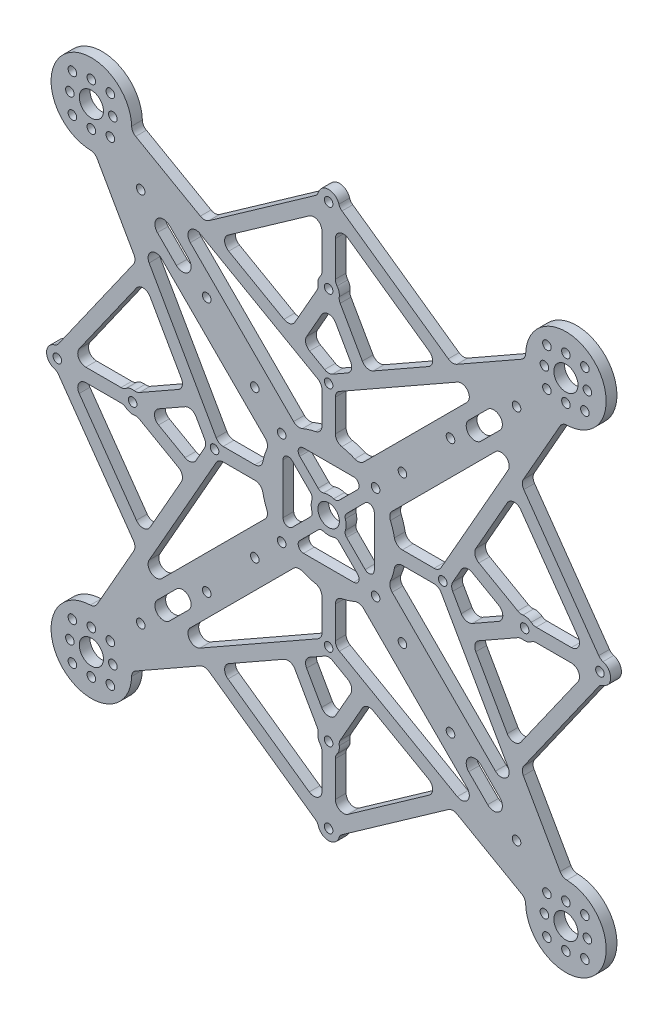
from build123d import *
from build123d.topology import SkipClean

# Parameters (mm, degrees)
SKETCH_1_W                 = 212.132034356
SKETCH_1_H                 = 212.132034356
SKETCH_1_R                 = 4.5
EXTRUDE_1_DEPTH            = 4
SKETCH_5_R                 = 1.6
CUT_EXTRUDE_5_DEPTH        = 4
SKETCH_6_R                 = 1.6
CUT_EXTRUDE_6_DEPTH        = 4
SKETCH_7_R                 = 4
CUT_EXTRUDE_9_DEPTH        = 10
FILLET_3_R                 = 2
SKETCH_8_R                 = 1.6
CUT_EXTRUDE_10_DEPTH       = 10
CUT_EXTRUDE_11_DEPTH       = 10
EXTRUDE_START              = -4
EXTRUDE_5_DEPTH            = 4
MIRROR_START               = -4
MIRROR_2_COPY_1_DEPTH      = 4
MIRROR_3_COPY_1_DEPTH      = 4
MIRROR_3_COPY_2_DEPTH      = 4
MIRROR_3_COPY_3_DEPTH      = 4
CUT_EXTRUDE_12_DEPTH       = 4
SKETCH_12_R                = 1.6
CUT_EXTRUDE_13_DEPTH       = 4
SKETCH_13_R                = 4
SKETCH_13_R_2              = 1.6
EXTRUDE_6_DEPTH            = 4
MIRROR_5_COPY_1_SKETCH_R   = 4
MIRROR_5_COPY_1_SKETCH_R_2 = 1.6
MIRROR_5_COPY_1_DEPTH      = 4
MIRROR_6_COPY_1_SKETCH_R   = 4
MIRROR_6_COPY_1_SKETCH_R_2 = 1.6
MIRROR_6_COPY_1_DEPTH      = 4
MIRROR_6_COPY_2_SKETCH_R   = 4
MIRROR_6_COPY_2_SKETCH_R_2 = 1.6
MIRROR_6_COPY_2_DEPTH      = 4
MIRROR_6_COPY_3_SKETCH_R   = 4
MIRROR_6_COPY_3_SKETCH_R_2 = 1.6
MIRROR_6_COPY_3_DEPTH      = 4
CUT_EXTRUDE_14_DEPTH       = 4
PATTERN_CIRCULAR_1_COUNT   = 4
FILLET_4_R                 = 3
SKETCH_15_R                = 1.6
CUT_EXTRUDE_15_DEPTH       = 10
CUT_EXTRUDE_16_DEPTH       = 10


# Read off the part's stored shape, not the designer's step: 凸台-拉伸5
with BuildPart() as part:
    # 草图1 → 凸台-拉伸1 (new body)
    with BuildSketch(Plane.XY):
        Rectangle(SKETCH_1_W, SKETCH_1_H)
        with Locations((-88.388347648, -88.388347648)):
            Circle(SKETCH_1_R, mode=Mode.SUBTRACT)
        with Locations((88.388347648, -88.388347648)):
            Circle(SKETCH_1_R, mode=Mode.SUBTRACT)
        with Locations(Location((88.388347648, 88.388347648, 0), (0, 0, 180))):
            Circle(SKETCH_1_R, mode=Mode.SUBTRACT)
        with Locations(Location((-88.388347648, 88.388347648, 0), (0, 0, 180))):
            Circle(SKETCH_1_R, mode=Mode.SUBTRACT)
    extrude(amount=EXTRUDE_1_DEPTH)

    # 草图5 → 切除-拉伸5 (cut)
    with BuildSketch(Plane.XY.offset(4)):
        with Locations((96.388347648, -88.388347648)):
            Circle(SKETCH_5_R)
        with Locations((88.388347648, -96.388347648)):
            Circle(SKETCH_5_R)
        with Locations(Location((80.388347648, -88.388347648, 0), (0, 0, 180))):
            Circle(SKETCH_5_R)
        with Locations(Location((88.388347648, -80.388347648, 0), (0, 0, 180))):
            Circle(SKETCH_5_R)
        with Locations((-88.388347648, -80.388347648)):
            Circle(SKETCH_5_R)
        with Locations((-80.388347648, -88.388347648)):
            Circle(SKETCH_5_R)
        with Locations(Location((-88.388347648, -96.388347648, 0), (0, 0, 180))):
            Circle(SKETCH_5_R)
        with Locations(Location((-96.388347648, -88.388347648, 0), (0, 0, 180))):
            Circle(SKETCH_5_R)
        with Locations((-96.388347648, 88.388347648)):
            Circle(SKETCH_5_R)
        with Locations((-88.388347648, 96.388347648)):
            Circle(SKETCH_5_R)
        with Locations(Location((-80.388347648, 88.388347648, 0), (0, 0, 180))):
            Circle(SKETCH_5_R)
        with Locations(Location((-88.388347648, 80.388347648, 0), (0, 0, 180))):
            Circle(SKETCH_5_R)
        with Locations((88.388347648, 80.388347648)):
            Circle(SKETCH_5_R)
        with Locations((80.388347648, 88.388347648)):
            Circle(SKETCH_5_R)
        with Locations(Location((88.388347648, 96.388347648, 0), (0, 0, 180))):
            Circle(SKETCH_5_R)
        with Locations(Location((96.388347648, 88.388347648, 0), (0, 0, 180))):
            Circle(SKETCH_5_R)
    extrude(amount=-CUT_EXTRUDE_5_DEPTH, mode=Mode.SUBTRACT)

    # 草图6 → 切除-拉伸6 (cut)
    with BuildSketch(Plane.XY.offset(4)):
        with Locations((-45.4, 47.5)):
            Circle(SKETCH_6_R)
        with Locations((-45.4, -47.5)):
            Circle(SKETCH_6_R)
        with Locations(Location((45.4, -47.5, 0), (0, 0, 180))):
            Circle(SKETCH_6_R)
        with Locations(Location((45.4, 47.5, 0), (0, 0, 180))):
            Circle(SKETCH_6_R)
        with Locations((-17.5, 17.5)):
            Circle(SKETCH_6_R)
        with Locations((-17.5, -17.5)):
            Circle(SKETCH_6_R)
        with Locations(Location((17.5, -17.5, 0), (0, 0, 180))):
            Circle(SKETCH_6_R)
        with Locations(Location((17.5, 17.5, 0), (0, 0, 180))):
            Circle(SKETCH_6_R)
        with Locations((-73, 0)):
            Circle(SKETCH_6_R)
        with Locations((0, -73)):
            Circle(SKETCH_6_R)
        with Locations(Location((0, 73, 0), (0, 0, 180))):
            Circle(SKETCH_6_R)
        with Locations(Location((73, 0, 0), (0, 0, 180))):
            Circle(SKETCH_6_R)
        with Locations((-42.5, 0)):
            Circle(SKETCH_6_R)
        with Locations((0, -42.5)):
            Circle(SKETCH_6_R)
        with Locations(Location((42.5, 0, 0), (0, 0, 180))):
            Circle(SKETCH_6_R)
        with Locations(Location((0, 42.5, 0), (0, 0, 180))):
            Circle(SKETCH_6_R)
    extrude(amount=-CUT_EXTRUDE_6_DEPTH, mode=Mode.SUBTRACT)

    # 草图7 → 切除-拉伸9 (cut)
    with BuildSketch(Plane.XY.offset(4)):
        Circle(SKETCH_7_R)
        with BuildLine():
            Line((-17, 14.171572875), (-17, -14.171572875))
            Line((-17, -14.171572875), (-5.787427484, -2.959000359))
            ThreePointArc((-5.787427484, -2.959000359), (-6.5, 0), (-5.787427484, 2.959000359))
            Line((-5.787427484, 2.959000359), (-17, 14.171572875))
        make_face()
        with BuildLine():
            Line((-14.171572875, 17), (-2.959000359, 5.787427484))
            ThreePointArc((-2.959000359, 5.787427484), (0, 6.5), (2.959000359, 5.787427484))
            Line((2.959000359, 5.787427484), (14.171572875, 17))
            Line((14.171572875, 17), (-14.171572875, 17))
        make_face()
        with BuildLine():
            Line((17, 14.171572875), (5.787427484, 2.959000359))
            ThreePointArc((5.787427484, 2.959000359), (6.5, 0), (5.787427484, -2.959000359))
            Line((5.787427484, -2.959000359), (17, -14.171572875))
            Line((17, -14.171572875), (17, 14.171572875))
        make_face()
        with BuildLine():
            Line((-14.171572875, -17), (-2.959000359, -5.787427484))
            ThreePointArc((-2.959000359, -5.787427484), (0, -6.5), (2.959000359, -5.787427484))
            Line((2.959000359, -5.787427484), (14.171572875, -17))
            Line((14.171572875, -17), (-14.171572875, -17))
        make_face()
    extrude(amount=-CUT_EXTRUDE_9_DEPTH, mode=Mode.SUBTRACT)

    # 圆角3
    fillet_3_edges = [part.edges().sort_by_distance(p)[0] for p in [
        (5.787427484, -2.959000359, 2),
        (5.787427484, 2.959000359, 2),
        (17, 14.171572875, 2),
        (17, -14.171572875, 2),
        (2.959000359, 5.787427484, 2),
        (-2.959000359, 5.787427484, 2),
        (-14.171572875, 17, 2),
        (14.171572875, 17, 2),
        (-2.959000359, -5.787427484, 2),
        (2.959000359, -5.787427484, 2),
        (14.171572875, -17, 2),
        (-14.171572875, -17, 2),
        (-5.787427484, 2.959000359, 2),
        (-5.787427484, -2.959000359, 2),
        (-17, -14.171572875, 2),
        (-17, 14.171572875, 2),
    ]]
    fillet(fillet_3_edges, radius=FILLET_3_R)

    # 草图8 → 切除-拉伸10 (cut)
    with BuildSketch(Plane.XY.offset(4)):
        with Locations((-70, -70)):
            Circle(SKETCH_8_R)
        with Locations((-27.5, -27.5)):
            Circle(SKETCH_8_R)
        with Locations((-27.5, 27.5)):
            Circle(SKETCH_8_R)
        with Locations((-70, 70)):
            Circle(SKETCH_8_R)
        with Locations((70, 70)):
            Circle(SKETCH_8_R)
        with Locations((27.5, 27.5)):
            Circle(SKETCH_8_R)
        with Locations((27.5, -27.5)):
            Circle(SKETCH_8_R)
        with Locations((70, -70)):
            Circle(SKETCH_8_R)
    extrude(amount=-CUT_EXTRUDE_10_DEPTH, mode=Mode.SUBTRACT)

    # 草图9 → 切除-拉伸11 (cut)
    with BuildSketch(Plane.XY.offset(4)):
        with BuildLine():
            Line((11.560121095, -22.166722813), (73.899460254, -84.506061972))
            ThreePointArc((73.899460254, -84.506061972), (98.994949366, -98.994949366), (84.506061972, -73.899460254))
            Line((84.506061972, -73.899460254), (22.166722813, -11.560121095))
            ThreePointArc((22.166722813, -11.560121095), (23.952974401, -7.159260951), (24.874685928, -2.5))
            Line((24.874685928, -2.5), (106.066017178, -2.5))
            Line((106.066017178, -2.5), (106.066017178, -106.066017178))
            Line((106.066017178, -106.066017178), (2.5, -106.066017178))
            Line((2.5, -106.066017178), (2.5, -24.874685928))
            ThreePointArc((2.5, -24.874685928), (7.159260951, -23.952974401), (11.560121095, -22.166722813))
        make_face()
        with BuildLine():
            Line((2.5, 106.066017178), (106.066017178, 106.066017178))
            Line((106.066017178, 106.066017178), (106.066017178, 2.5))
            Line((106.066017178, 2.5), (24.874685928, 2.5))
            ThreePointArc((24.874685928, 2.5), (23.952974401, 7.159260951), (22.166722813, 11.560121095))
            Line((22.166722813, 11.560121095), (84.506061972, 73.899460254))
            ThreePointArc((84.506061972, 73.899460254), (98.994949366, 98.994949366), (73.899460254, 84.506061972))
            Line((73.899460254, 84.506061972), (11.560121095, 22.166722813))
            ThreePointArc((11.560121095, 22.166722813), (7.159260951, 23.952974401), (2.5, 24.874685928))
            Line((2.5, 24.874685928), (2.5, 106.066017178))
        make_face()
        with BuildLine():
            Line((-2.5, -106.066017178), (-2.5, -24.874685928))
            ThreePointArc((-2.5, -24.874685928), (-7.159260951, -23.952974401), (-11.560121095, -22.166722813))
            Line((-11.560121095, -22.166722813), (-73.899460254, -84.506061972))
            ThreePointArc((-73.899460254, -84.506061972), (-98.994949366, -98.994949366), (-84.506061972, -73.899460254))
            Line((-84.506061972, -73.899460254), (-22.166722813, -11.560121095))
            ThreePointArc((-22.166722813, -11.560121095), (-23.952974401, -7.159260951), (-24.874685928, -2.5))
            Line((-24.874685928, -2.5), (-106.066017178, -2.5))
            Line((-106.066017178, -2.5), (-106.066017178, -106.066017178))
            Line((-106.066017178, -106.066017178), (-2.5, -106.066017178))
        make_face()
        with BuildLine():
            Line((-106.066017178, 2.5), (-24.874685928, 2.5))
            ThreePointArc((-24.874685928, 2.5), (-23.952974401, 7.159260951), (-22.166722813, 11.560121095))
            Line((-22.166722813, 11.560121095), (-84.506061972, 73.899460254))
            ThreePointArc((-84.506061972, 73.899460254), (-98.994949366, 98.994949366), (-73.899460254, 84.506061972))
            Line((-73.899460254, 84.506061972), (-11.560121095, 22.166722813))
            ThreePointArc((-11.560121095, 22.166722813), (-7.159260951, 23.952974401), (-2.5, 24.874685928))
            Line((-2.5, 24.874685928), (-2.5, 106.066017178))
            Line((-2.5, 106.066017178), (-106.066017178, 106.066017178))
            Line((-106.066017178, 106.066017178), (-106.066017178, 2.5))
        make_face()
    extrude(amount=-CUT_EXTRUDE_11_DEPTH, mode=Mode.SUBTRACT)

    # 凸台-拉伸5 outline → 凸台-拉伸5 (add)
    with BuildSketch(Plane.XY.offset(4).offset(EXTRUDE_START)):
        with BuildLine():
            Line((-87.121646236, 73.441927758), (-53.356969221, 14.041182011))
            Line((-53.356969221, 14.041182011), (-71.520820331, 3.71645362))
            ThreePointArc((-71.520820331, 3.71645362), (-74.022283942, 3.867161174), (-76.122498999, 2.5))
            Line((-76.122498999, 2.5), (-63.542839873, 2.5))
            Line((-63.542839873, 2.5), (-50.886133741, 9.694347297))
            Line((-50.886133741, 9.694347297), (-46.796710119, 2.5))
            Line((-46.796710119, 2.5), (-36.464466094, 2.5))
            Line((-36.464466094, 2.5), (-24.785533906, 14.178932188))
            Line((-24.785533906, 14.178932188), (-28.321067812, 17.714466094))
            Line((-28.321067812, 17.714466094), (-41.947864553, 4.087669353))
            Line((-41.947864553, 4.087669353), (-77.842946243, 67.236344525))
            Line((-77.842946243, 67.236344525), (-84.506061972, 73.899460254))
            ThreePointArc((-84.506061972, 73.899460254), (-85.803710148, 73.612703872), (-87.121646236, 73.441927758))
        make_face()
        with BuildLine():
            Line((-69.877501001, -2.5), (-76.122498999, -2.5))
            ThreePointArc((-76.122498999, -2.5), (-73, -4), (-69.877501001, -2.5))
        make_face()
        with BuildLine():
            Line((-39.377501001, -2.5), (-45.622498999, -2.5))
            ThreePointArc((-45.622498999, -2.5), (-42.5, -4), (-39.377501001, -2.5))
        make_face()
    extrude_5 = extrude(amount=EXTRUDE_5_DEPTH)

    # 镜向1: 凸台-拉伸5 across plane
    add(extrude_5.mirror(Plane(origin=(0, 0, 0), x_dir=(0, 0, 1), z_dir=(0, -1, 0))))

    # 镜向2: 凸台-拉伸5 across plane
    add(extrude_5.mirror(Plane(origin=(0, 0, 0), x_dir=(0, 0, 1), z_dir=(0.7071067811865476, -0.7071067811865476, 0))))

    # 镜向2 copy 1 sketch → 镜向2 copy 1 (add)
    with BuildSketch(Plane(origin=(0, 0, 4), x_dir=(0, 1, 0), z_dir=(0, 0, 1)).offset(MIRROR_START)):
        with BuildLine():
            Line((-87.121646236, 73.441927758), (-53.356969221, 14.041182011))
            Line((-53.356969221, 14.041182011), (-71.520820331, 3.71645362))
            ThreePointArc((-71.520820331, 3.71645362), (-74.022283942, 3.867161174), (-76.122498999, 2.5))
            Line((-76.122498999, 2.5), (-63.542839873, 2.5))
            Line((-63.542839873, 2.5), (-50.886133741, 9.694347297))
            Line((-50.886133741, 9.694347297), (-46.796710119, 2.5))
            Line((-46.796710119, 2.5), (-36.464466094, 2.5))
            Line((-36.464466094, 2.5), (-24.785533906, 14.178932188))
            Line((-24.785533906, 14.178932188), (-28.321067812, 17.714466094))
            Line((-28.321067812, 17.714466094), (-41.947864553, 4.087669353))
            Line((-41.947864553, 4.087669353), (-77.842946243, 67.236344525))
            Line((-77.842946243, 67.236344525), (-84.506061972, 73.899460254))
            ThreePointArc((-84.506061972, 73.899460254), (-85.803710148, 73.612703872), (-87.121646236, 73.441927758))
        make_face()
        with BuildLine():
            Line((-69.877501001, -2.5), (-76.122498999, -2.5))
            ThreePointArc((-76.122498999, -2.5), (-73, -4), (-69.877501001, -2.5))
        make_face()
        with BuildLine():
            Line((-39.377501001, -2.5), (-45.622498999, -2.5))
            ThreePointArc((-45.622498999, -2.5), (-42.5, -4), (-39.377501001, -2.5))
        make_face()
    extrude(amount=MIRROR_2_COPY_1_DEPTH)

    # 镜向3: 凸台-拉伸5 across plane
    add(extrude_5.mirror(Plane(origin=(0, 0, 0), x_dir=(0, 0, 1), z_dir=(-0.7071067811865471, -0.7071067811865479, 0))))

    # 镜向3 copy 1 sketch → 镜向3 copy 1 (add)
    with BuildSketch(Plane(origin=(0, 0, 4), x_dir=(0, -1, 0), z_dir=(0, 0, 1)).offset(MIRROR_START)):
        with BuildLine():
            Line((-87.121646236, 73.441927758), (-53.356969221, 14.041182011))
            Line((-53.356969221, 14.041182011), (-71.520820331, 3.71645362))
            ThreePointArc((-71.520820331, 3.71645362), (-74.022283942, 3.867161174), (-76.122498999, 2.5))
            Line((-76.122498999, 2.5), (-63.542839873, 2.5))
            Line((-63.542839873, 2.5), (-50.886133741, 9.694347297))
            Line((-50.886133741, 9.694347297), (-46.796710119, 2.5))
            Line((-46.796710119, 2.5), (-36.464466094, 2.5))
            Line((-36.464466094, 2.5), (-24.785533906, 14.178932188))
            Line((-24.785533906, 14.178932188), (-28.321067812, 17.714466094))
            Line((-28.321067812, 17.714466094), (-41.947864553, 4.087669353))
            Line((-41.947864553, 4.087669353), (-77.842946243, 67.236344525))
            Line((-77.842946243, 67.236344525), (-84.506061972, 73.899460254))
            ThreePointArc((-84.506061972, 73.899460254), (-85.803710148, 73.612703872), (-87.121646236, 73.441927758))
        make_face()
        with BuildLine():
            Line((-69.877501001, -2.5), (-76.122498999, -2.5))
            ThreePointArc((-76.122498999, -2.5), (-73, -4), (-69.877501001, -2.5))
        make_face()
        with BuildLine():
            Line((-39.377501001, -2.5), (-45.622498999, -2.5))
            ThreePointArc((-45.622498999, -2.5), (-42.5, -4), (-39.377501001, -2.5))
        make_face()
    extrude(amount=MIRROR_3_COPY_1_DEPTH)

    # 镜向3 copy 2 sketch → 镜向3 copy 2 (add)
    with BuildSketch(Plane(origin=(0, 0, 4), x_dir=(-1, 0, 0), z_dir=(0, 0, 1)).offset(MIRROR_START)):
        with BuildLine():
            Line((-87.121646236, 73.441927758), (-53.356969221, 14.041182011))
            Line((-53.356969221, 14.041182011), (-71.520820331, 3.71645362))
            ThreePointArc((-71.520820331, 3.71645362), (-74.022283942, 3.867161174), (-76.122498999, 2.5))
            Line((-76.122498999, 2.5), (-63.542839873, 2.5))
            Line((-63.542839873, 2.5), (-50.886133741, 9.694347297))
            Line((-50.886133741, 9.694347297), (-46.796710119, 2.5))
            Line((-46.796710119, 2.5), (-36.464466094, 2.5))
            Line((-36.464466094, 2.5), (-24.785533906, 14.178932188))
            Line((-24.785533906, 14.178932188), (-28.321067812, 17.714466094))
            Line((-28.321067812, 17.714466094), (-41.947864553, 4.087669353))
            Line((-41.947864553, 4.087669353), (-77.842946243, 67.236344525))
            Line((-77.842946243, 67.236344525), (-84.506061972, 73.899460254))
            ThreePointArc((-84.506061972, 73.899460254), (-85.803710148, 73.612703872), (-87.121646236, 73.441927758))
        make_face()
        with BuildLine():
            Line((-69.877501001, -2.5), (-76.122498999, -2.5))
            ThreePointArc((-76.122498999, -2.5), (-73, -4), (-69.877501001, -2.5))
        make_face()
        with BuildLine():
            Line((-39.377501001, -2.5), (-45.622498999, -2.5))
            ThreePointArc((-45.622498999, -2.5), (-42.5, -4), (-39.377501001, -2.5))
        make_face()
    extrude(amount=MIRROR_3_COPY_2_DEPTH)

    # 镜向3 copy 3 sketch → 镜向3 copy 3 (add)
    with BuildSketch(Plane(origin=(0, 0, 4), x_dir=(-1, 0, 0), z_dir=(0, 0, 1)).offset(MIRROR_START)):
        with BuildLine():
            Line((-87.121646236, -73.441927758), (-53.356969221, -14.041182011))
            Line((-53.356969221, -14.041182011), (-71.520820331, -3.71645362))
            ThreePointArc((-71.520820331, -3.71645362), (-74.022283942, -3.867161174), (-76.122498999, -2.5))
            Line((-76.122498999, -2.5), (-63.542839873, -2.5))
            Line((-63.542839873, -2.5), (-50.886133741, -9.694347297))
            Line((-50.886133741, -9.694347297), (-46.796710119, -2.5))
            Line((-46.796710119, -2.5), (-36.464466094, -2.5))
            Line((-36.464466094, -2.5), (-24.785533906, -14.178932188))
            Line((-24.785533906, -14.178932188), (-28.321067812, -17.714466094))
            Line((-28.321067812, -17.714466094), (-41.947864553, -4.087669353))
            Line((-41.947864553, -4.087669353), (-77.842946243, -67.236344525))
            Line((-77.842946243, -67.236344525), (-84.506061972, -73.899460254))
            ThreePointArc((-84.506061972, -73.899460254), (-85.803710148, -73.612703872), (-87.121646236, -73.441927758))
        make_face()
        with BuildLine():
            Line((-69.877501001, 2.5), (-76.122498999, 2.5))
            ThreePointArc((-76.122498999, 2.5), (-73, 4), (-69.877501001, 2.5))
        make_face()
        with BuildLine():
            Line((-39.377501001, 2.5), (-45.622498999, 2.5))
            ThreePointArc((-45.622498999, 2.5), (-42.5, 4), (-39.377501001, 2.5))
        make_face()
    extrude(amount=MIRROR_3_COPY_3_DEPTH)

    # 草图11 → 切除-拉伸12 (cut)
    with BuildSketch(Plane.XY.offset(4)):
        Polygon((-50.886133741, 9.694347297), (-67.940982473, 0), (-50.886133741, -9.694347297), (-45.375655695, 0), align=None)
        Polygon((-28.321067812, 17.714466094), (-24.785533906, 14.178932188), (-36.464466094, 2.5), (-41.045398729, 2.5), (-41.947864553, 4.087669353), align=None)
        Polygon((-28.321067812, -17.714466094), (-24.785533906, -14.178932188), (-36.464466094, -2.5), (-41.045398729, -2.5), (-41.947864553, -4.087669353), align=None)
        Polygon((-9.694347297, -50.886133741), (0, -45.375655695), (9.694347297, -50.886133741), (0, -67.940982473), align=None)
        Polygon((-17.714466094, -28.321067812), (-4.087669353, -41.947864553), (-2.5, -41.045398729), (-2.5, -36.464466094), (-14.178932188, -24.785533906), align=None)
        Polygon((17.714466094, -28.321067812), (14.178932188, -24.785533906), (2.5, -36.464466094), (2.5, -41.045398729), (4.087669353, -41.947864553), align=None)
        Polygon((28.321067812, -17.714466094), (41.947864553, -4.087669353), (41.045398729, -2.5), (36.464466094, -2.5), (24.785533906, -14.178932188), align=None)
        Polygon((28.321067812, 17.714466094), (24.785533906, 14.178932188), (36.464466094, 2.5), (41.045398729, 2.5), (41.947864553, 4.087669353), align=None)
        Polygon((45.375655695, 0), (50.886133741, -9.694347297), (67.940982473, 0), (50.886133741, 9.694347297), align=None)
        Polygon((17.714466094, 28.321067812), (4.087669353, 41.947864553), (2.5, 41.045398729), (2.5, 36.464466094), (14.178932188, 24.785533906), align=None)
        Polygon((-4.087669353, 41.947864553), (-2.5, 41.045398729), (-2.5, 36.464466094), (-14.178932188, 24.785533906), (-17.714466094, 28.321067812), align=None)
        Polygon((0, 45.375655695), (-9.694347297, 50.886133741), (0, 67.940982473), (9.694347297, 50.886133741), align=None)
    extrude(amount=-CUT_EXTRUDE_12_DEPTH, mode=Mode.SUBTRACT)

    # 草图12 → 切除-拉伸13 (cut)
    with BuildSketch(Plane.XY.offset(4)):
        with Locations((-101.066017178, 0)):
            Circle(SKETCH_12_R)
        with Locations((0, -101.066017178)):
            Circle(SKETCH_12_R)
        with Locations(Location((101.066017178, 0, 0), (0, 0, 180))):
            Circle(SKETCH_12_R)
        with Locations(Location((0, 101.066017178, 0), (0, 0, 180))):
            Circle(SKETCH_12_R)
    extrude(amount=-CUT_EXTRUDE_13_DEPTH, mode=Mode.SUBTRACT)

    # 草图13 → 凸台-拉伸6 (add)
    # profile 1 of 2: a face of its own
    with BuildSketch(Plane.XY.offset(4)):
        with BuildLine():
            Line((-97.223747289, 1.11218798), (-68.87382069, 41.3393122))
            Line((-68.87382069, 41.3393122), (-71.604794767, 46.14379757))
            Line((-71.604794767, 46.14379757), (-101.310772469, 3.992504834))
            ThreePointArc((-101.310772469, 3.992504834), (-98.761763695, 3.269620144), (-97.223747289, 1.11218798))
        make_face()
    # profile 2 of 2: a face of its own
    with BuildSketch(Plane.XY.offset(4)):
        with Locations((-101.066017178, 0)):
            Circle(SKETCH_13_R)
        with Locations((-101.066017178, 0)):
            Circle(SKETCH_13_R_2, mode=Mode.SUBTRACT)
    extrude_6 = extrude(amount=-EXTRUDE_6_DEPTH)

    # 镜向4: 凸台-拉伸6 across plane
    add(extrude_6.mirror(Plane(origin=(0, 0, 0), x_dir=(0, 0, 1), z_dir=(0, -1, 0))))

    # 镜向5: 凸台-拉伸6 across plane
    add(extrude_6.mirror(Plane(origin=(0, 0, 0), x_dir=(0, 0, 1), z_dir=(0.7071067811865476, -0.7071067811865476, 0))))

    # 镜向5 copy 1 sketch → 镜向5 copy 1 (add)
    # profile 1 of 2: a face of its own
    with BuildSketch(Plane(origin=(0, 0, 4), x_dir=(0, 1, 0), z_dir=(0, 0, 1))):
        with BuildLine():
            Line((-97.223747289, 1.11218798), (-68.87382069, 41.3393122))
            Line((-68.87382069, 41.3393122), (-71.604794767, 46.14379757))
            Line((-71.604794767, 46.14379757), (-101.310772469, 3.992504834))
            ThreePointArc((-101.310772469, 3.992504834), (-98.761763695, 3.269620144), (-97.223747289, 1.11218798))
        make_face()
    # profile 2 of 2: a face of its own
    with BuildSketch(Plane(origin=(0, 0, 4), x_dir=(0, 1, 0), z_dir=(0, 0, 1))):
        with Locations((-101.066017178, 0)):
            Circle(MIRROR_5_COPY_1_SKETCH_R)
        with Locations((-101.066017178, 0)):
            Circle(MIRROR_5_COPY_1_SKETCH_R_2, mode=Mode.SUBTRACT)
    extrude(amount=-MIRROR_5_COPY_1_DEPTH)

    # 镜向6: 凸台-拉伸6 across plane
    add(extrude_6.mirror(Plane(origin=(0, 0, 0), x_dir=(0, 0, 1), z_dir=(-0.7071067811865471, -0.7071067811865479, 0))))

    # 镜向6 copy 1 sketch → 镜向6 copy 1 (add)
    # profile 1 of 2: a face of its own
    with BuildSketch(Plane(origin=(0, 0, 4), x_dir=(0, -1, 0), z_dir=(0, 0, 1))):
        with BuildLine():
            Line((-97.223747289, 1.11218798), (-68.87382069, 41.3393122))
            Line((-68.87382069, 41.3393122), (-71.604794767, 46.14379757))
            Line((-71.604794767, 46.14379757), (-101.310772469, 3.992504834))
            ThreePointArc((-101.310772469, 3.992504834), (-98.761763695, 3.269620144), (-97.223747289, 1.11218798))
        make_face()
    # profile 2 of 2: a face of its own
    with BuildSketch(Plane(origin=(0, 0, 4), x_dir=(0, -1, 0), z_dir=(0, 0, 1))):
        with Locations((-101.066017178, 0)):
            Circle(MIRROR_6_COPY_1_SKETCH_R)
        with Locations((-101.066017178, 0)):
            Circle(MIRROR_6_COPY_1_SKETCH_R_2, mode=Mode.SUBTRACT)
    extrude(amount=-MIRROR_6_COPY_1_DEPTH)

    # 镜向6 copy 2 sketch → 镜向6 copy 2 (add)
    # profile 1 of 2: a face of its own
    with BuildSketch(Plane(origin=(0, 0, 4), x_dir=(-1, 0, 0), z_dir=(0, 0, 1))):
        with BuildLine():
            Line((-97.223747289, 1.11218798), (-68.87382069, 41.3393122))
            Line((-68.87382069, 41.3393122), (-71.604794767, 46.14379757))
            Line((-71.604794767, 46.14379757), (-101.310772469, 3.992504834))
            ThreePointArc((-101.310772469, 3.992504834), (-98.761763695, 3.269620144), (-97.223747289, 1.11218798))
        make_face()
    # profile 2 of 2: a face of its own
    with BuildSketch(Plane(origin=(0, 0, 4), x_dir=(-1, 0, 0), z_dir=(0, 0, 1))):
        with Locations((-101.066017178, 0)):
            Circle(MIRROR_6_COPY_2_SKETCH_R)
        with Locations((-101.066017178, 0)):
            Circle(MIRROR_6_COPY_2_SKETCH_R_2, mode=Mode.SUBTRACT)
    extrude(amount=-MIRROR_6_COPY_2_DEPTH)

    # 镜向6 copy 3 sketch → 镜向6 copy 3 (add)
    # profile 1 of 2: a face of its own
    with BuildSketch(Plane(origin=(0, 0, 4), x_dir=(-1, 0, 0), z_dir=(0, 0, 1))):
        with BuildLine():
            Line((-97.223747289, -1.11218798), (-68.87382069, -41.3393122))
            Line((-68.87382069, -41.3393122), (-71.604794767, -46.14379757))
            Line((-71.604794767, -46.14379757), (-101.310772469, -3.992504834))
            ThreePointArc((-101.310772469, -3.992504834), (-98.761763695, -3.269620144), (-97.223747289, -1.11218798))
        make_face()
    # profile 2 of 2: a face of its own
    with BuildSketch(Plane(origin=(0, 0, 4), x_dir=(-1, 0, 0), z_dir=(0, 0, 1))):
        with Locations((-101.066017178, 0)):
            Circle(MIRROR_6_COPY_3_SKETCH_R)
        with Locations((-101.066017178, 0)):
            Circle(MIRROR_6_COPY_3_SKETCH_R_2, mode=Mode.SUBTRACT)
    extrude(amount=-MIRROR_6_COPY_3_DEPTH)

    # 草图14 → 切除-拉伸14 (cut)
    with SkipClean():  # the faces are left unmerged after this step: merging them gives an invalid solid
        with BuildSketch(Plane.XY.offset(4)):
            with BuildLine():
                Line((-104.188516177, 2.5), (-106.066017178, 2.5))
                Line((-106.066017178, 2.5), (-106.066017178, -2.5))
                Line((-106.066017178, -2.5), (-104.188516177, -2.5))
                ThreePointArc((-104.188516177, -2.5), (-105.066017178, 0), (-104.188516177, 2.5))
            make_face()
        cut_extrude_14 = extrude(amount=-CUT_EXTRUDE_14_DEPTH, mode=Mode.SUBTRACT)

    # 阵列(圆周)1: 切除-拉伸14 ×4 about axis
    with SkipClean():  # the faces are left unmerged after this step: merging them gives an invalid solid
        pattern_circular_1_axis = Axis((0, 0, 0), (0, 0, 1))
        for i in range(1, PATTERN_CIRCULAR_1_COUNT):
            add(cut_extrude_14.rotate(pattern_circular_1_axis, i * 360 / PATTERN_CIRCULAR_1_COUNT), mode=Mode.SUBTRACT)

    # 圆角4
    fillet_4_edges = [part.edges().sort_by_distance(p)[0] for p in [
        (50.886133741, -9.694347297, 2),
        (76.122498999, -2.5, 2),
        (71.520820331, -3.71645362, 2),
        (53.356969221, -14.041182011, 2),
        (87.121646236, -73.441927758, 2),
        (77.842946243, -67.236344525, 2),
        (50.886133741, 9.694347297, 2),
        (71.520820331, 3.71645362, 2),
        (53.356969221, 14.041182011, 2),
        (77.842946243, 67.236344525, 2),
        (87.121646236, 73.441927758, 2),
        (-9.694347297, 50.886133741, 2),
        (-3.71645362, 71.520820331, 2),
        (-14.041182011, 53.356969221, 2),
        (-67.236344525, 77.842946243, 2),
        (-73.441927758, 87.121646236, 2),
        (-67.940982473, 0, 2),
        (-45.375655695, 0, 2),
        (2.5, -41.045398729, 2),
        (41.045398729, -2.5, 2),
        (41.045398729, 2.5, 2),
        (67.940982473, 0, 2),
        (45.375655695, 0, 2),
        (-2.5, -41.045398729, 2),
        (0, -45.375655695, 2),
        (0, -67.940982473, 2),
        (-41.045398729, -2.5, 2),
        (-41.045398729, 2.5, 2),
        (2.5, 41.045398729, 2),
        (-2.5, 41.045398729, 2),
        (0, 67.940982473, 2),
        (0, 45.375655695, 2),
        (-96.24569157, 2.5, 2),
        (-68.87382069, 41.3393122, 2),
        (-101.310772469, 3.992504834, 2),
        (-71.604794767, 46.14379757, 2),
        (-101.310772469, -3.992504834, 2),
        (-71.604794767, -46.14379757, 2),
        (-96.24569157, -2.5, 2),
        (-68.87382069, -41.3393122, 2),
        (-2.5, -96.24569157, 2),
        (-41.3393122, -68.87382069, 2),
        (-3.992504834, -101.310772469, 2),
        (-46.14379757, -71.604794767, 2),
        (3.992504834, -101.310772469, 2),
        (46.14379757, -71.604794767, 2),
        (2.5, -96.24569157, 2),
        (41.3393122, -68.87382069, 2),
        (101.310772469, 3.992504834, 2),
        (71.604794767, 46.14379757, 2),
        (96.24569157, 2.5, 2),
        (68.87382069, 41.3393122, 2),
        (96.24569157, -2.5, 2),
        (68.87382069, -41.3393122, 2),
        (101.310772469, -3.992504834, 2),
        (71.604794767, -46.14379757, 2),
        (2.5, 96.24569157, 2),
        (41.3393122, 68.87382069, 2),
        (3.992504834, 101.310772469, 2),
        (46.14379757, 71.604794767, 2),
        (-3.992504834, 101.310772469, 2),
        (-46.14379757, 71.604794767, 2),
        (-2.5, 96.24569157, 2),
        (-41.3393122, 68.87382069, 2),
        (24.874685928, 2.5, 2),
        (22.166722813, 11.560121095, 2),
        (11.560121095, 22.166722813, 2),
        (2.5, 24.874685928, 2),
        (-24.874685928, -2.5, 2),
        (-22.166722813, -11.560121095, 2),
        (-11.560121095, -22.166722813, 2),
        (-2.5, -24.874685928, 2),
        (-22.166722813, 11.560121095, 2),
        (-2.5, 24.874685928, 2),
        (-11.560121095, 22.166722813, 2),
        (-24.874685928, 2.5, 2),
        (2.5, -24.874685928, 2),
        (11.560121095, -22.166722813, 2),
        (22.166722813, -11.560121095, 2),
        (24.874685928, -2.5, 2),
        (-76.122498999, 2.5, 2),
        (-50.886133741, 9.694347297, 2),
        (-76.122498999, -2.5, 2),
        (-71.520820331, 3.71645362, 2),
        (-53.356969221, 14.041182011, 2),
        (-87.121646236, 73.441927758, 2),
        (-77.842946243, 67.236344525, 2),
        (-50.886133741, -9.694347297, 2),
        (-71.520820331, -3.71645362, 2),
        (-53.356969221, -14.041182011, 2),
        (-77.842946243, -67.236344525, 2),
        (-87.121646236, -73.441927758, 2),
        (-2.5, -76.122498999, 2),
        (9.694347297, -50.886133741, 2),
        (2.5, -76.122498999, 2),
        (3.71645362, -71.520820331, 2),
        (14.041182011, -53.356969221, 2),
        (67.236344525, -77.842946243, 2),
        (73.441927758, -87.121646236, 2),
        (-9.694347297, -50.886133741, 2),
        (-3.71645362, -71.520820331, 2),
        (-14.041182011, -53.356969221, 2),
        (-73.441927758, -87.121646236, 2),
        (-67.236344525, -77.842946243, 2),
        (2.5, 76.122498999, 2),
        (9.694347297, 50.886133741, 2),
        (-2.5, 76.122498999, 2),
        (3.71645362, 71.520820331, 2),
        (14.041182011, 53.356969221, 2),
        (73.441927758, 87.121646236, 2),
        (67.236344525, 77.842946243, 2),
        (76.122498999, 2.5, 2),
    ]]
    fillet(fillet_4_edges, radius=FILLET_4_R)

    # 草图15 → 切除-拉伸15 (cut)
    with SkipClean():  # the faces are left unmerged after this step: merging them gives an invalid solid
        with BuildSketch(Plane.XY.offset(4)):
            with Locations((-81.317279836, -81.317279836)):
                Circle(SKETCH_15_R)
            with Locations((-81.317279836, -95.45941546)):
                Circle(SKETCH_15_R)
            with Locations((-95.45941546, -95.45941546)):
                Circle(SKETCH_15_R)
            with Locations((-95.45941546, -81.317279836)):
                Circle(SKETCH_15_R)
            with Locations((95.45941546, -81.317279836)):
                Circle(SKETCH_15_R)
            with Locations((95.45941546, -95.45941546)):
                Circle(SKETCH_15_R)
            with Locations((81.317279836, -95.45941546)):
                Circle(SKETCH_15_R)
            with Locations((81.317279836, -81.317279836)):
                Circle(SKETCH_15_R)
            with Locations((81.317279836, 81.317279836)):
                Circle(SKETCH_15_R)
            with Locations((81.317279836, 95.45941546)):
                Circle(SKETCH_15_R)
            with Locations((95.45941546, 95.45941546)):
                Circle(SKETCH_15_R)
            with Locations((95.45941546, 81.317279836)):
                Circle(SKETCH_15_R)
            with Locations((-95.45941546, 81.317279836)):
                Circle(SKETCH_15_R)
            with Locations((-95.45941546, 95.45941546)):
                Circle(SKETCH_15_R)
            with Locations((-81.317279836, 95.45941546)):
                Circle(SKETCH_15_R)
            with Locations((-81.317279836, 81.317279836)):
                Circle(SKETCH_15_R)
        extrude(amount=-CUT_EXTRUDE_15_DEPTH, mode=Mode.SUBTRACT)

    # 草图16 → 切除-拉伸16 (cut)
    with SkipClean():  # the faces are left unmerged after this step: merging them gives an invalid solid
        with BuildSketch(Plane(origin=(0, 0, 0), x_dir=(-1, 0, 0), z_dir=(0, 0, -1))):
            with BuildLine():
                Line((-63.781031663, -59.255548263), (-56.709963851, -52.184480452))
                ThreePointArc((-56.709963851, -52.184480452), (-52.184480452, -52.184480452), (-52.184480452, -56.709963851))
                Line((-52.184480452, -56.709963851), (-59.255548263, -63.781031663))
                ThreePointArc((-59.255548263, -63.781031663), (-63.781031663, -63.781031663), (-63.781031663, -59.255548263))
            make_face()
            with BuildLine():
                Line((63.781031663, -59.255548263), (56.709963851, -52.184480452))
                ThreePointArc((56.709963851, -52.184480452), (52.184480452, -52.184480452), (52.184480452, -56.709963851))
                Line((52.184480452, -56.709963851), (59.255548263, -63.781031663))
                ThreePointArc((59.255548263, -63.781031663), (63.781031663, -63.781031663), (63.781031663, -59.255548263))
            make_face()
            with BuildLine():
                Line((63.781031663, 59.255548263), (56.709963851, 52.184480452))
                ThreePointArc((56.709963851, 52.184480452), (52.184480452, 52.184480452), (52.184480452, 56.709963851))
                Line((52.184480452, 56.709963851), (59.255548263, 63.781031663))
                ThreePointArc((59.255548263, 63.781031663), (63.781031663, 63.781031663), (63.781031663, 59.255548263))
            make_face()
            with BuildLine():
                Line((-63.781031663, 59.255548263), (-56.709963851, 52.184480452))
                ThreePointArc((-56.709963851, 52.184480452), (-52.184480452, 52.184480452), (-52.184480452, 56.709963851))
                Line((-52.184480452, 56.709963851), (-59.255548263, 63.781031663))
                ThreePointArc((-59.255548263, 63.781031663), (-63.781031663, 63.781031663), (-63.781031663, 59.255548263))
            make_face()
        extrude(amount=-CUT_EXTRUDE_16_DEPTH, mode=Mode.SUBTRACT)


solid = part.part
